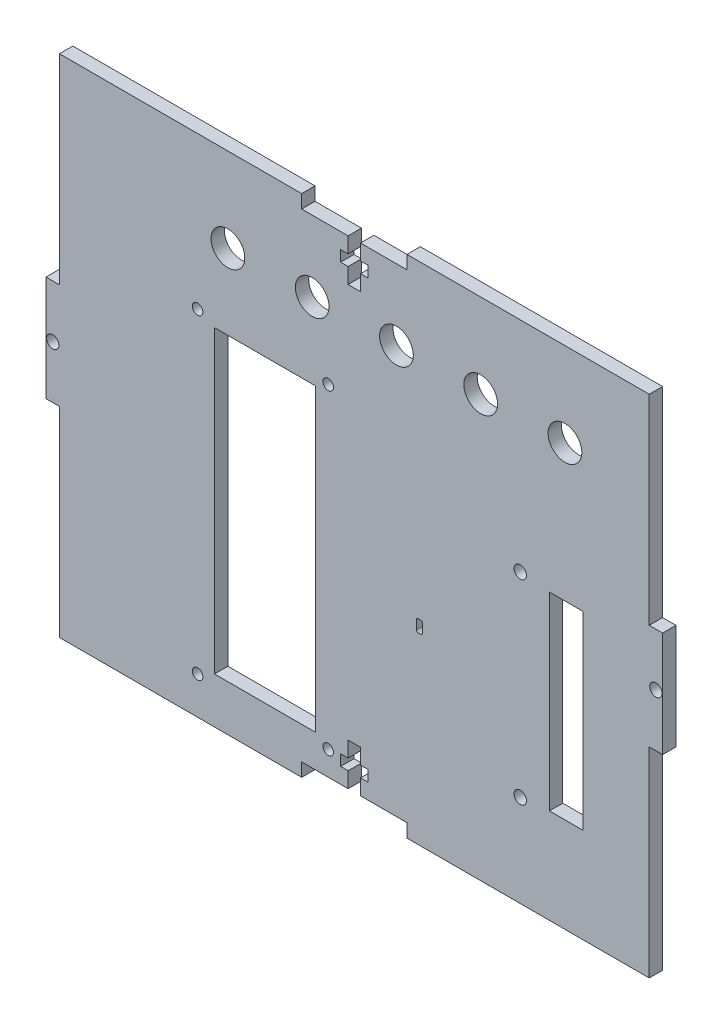
from build123d import *

# Parameters (mm, degrees)
SKETCH1_R           = 1.47
BOSS_EXTRUDE1_DEPTH = 1.5875
SKETCH3_W           = 8
SKETCH3_H           = 45
CUT_EXTRUDE1_DEPTH  = 95.681895049
SKETCH4_W           = 24
SKETCH4_H           = 71.2
CUT_EXTRUDE2_DEPTH  = 95.681895049
CUT_EXTRUDE4_DEPTH  = 95.681895049
SKETCH6_R           = 4
CUT_EXTRUDE5_DEPTH  = 95.681895049
SKETCH9_R           = 1.25
SKETCH9_R_2         = 1.47
CUT_EXTRUDE6_DEPTH  = 95.681895049


with BuildPart() as part:
    # Sketch1 → Boss-Extrude1 (new, symmetric)
    with BuildSketch(Plane.XY):
        Polygon((-12.5, 60), (-70, 60), (-70, 12.5), (-73.175, 12.5), (-73.175, -12.5), (-70, -12.5), (-70, -60), (-12.5, -60), (-12.5, -56.825), (-1.47, -56.825), (-1.47, -53.125), (-3.25, -53.125), (-3.25, -50.525), (-1.47, -50.525), (-1.47, -46.825), (1.47, -46.825), (1.47, -50.525), (3.25, -50.525), (3.25, -53.125), (1.47, -53.125), (1.47, -56.825), (12.5, -56.825), (12.5, -60), (70, -60), (70, -12.5), (73.175, -12.5), (73.175, 12.5), (70, 12.5), (70, 60), (12.5, 60), (12.5, 56.825), (1.47, 56.825), (1.47, 53.125), (3.25, 53.125), (3.25, 50.525), (1.47, 50.525), (1.47, 46.825), (-1.47, 46.825), (-1.47, 50.525), (-3.25, 50.525), (-3.25, 53.125), (-1.47, 53.125), (-1.47, 56.825), (-12.5, 56.825), align=None)
        with Locations((71.5875, 0)):
            Circle(SKETCH1_R, mode=Mode.SUBTRACT)
        with Locations((-71.5875, 0)):
            Circle(SKETCH1_R, mode=Mode.SUBTRACT)
    extrude(amount=BOSS_EXTRUDE1_DEPTH, both=True)

    # Sketch3 → Cut-Extrude1 (cut, through all)
    with BuildSketch(Plane(origin=(0, 0, -1.5875), x_dir=(-1, 0, 0), z_dir=(0, 0, -1))):
        with Locations((-50.3, -15)):
            Rectangle(SKETCH3_W, SKETCH3_H)
    extrude(amount=-CUT_EXTRUDE1_DEPTH, mode=Mode.SUBTRACT)

    # Sketch4 → Cut-Extrude2 (cut, through all)
    with BuildSketch(Plane(origin=(0, 0, -1.5875), x_dir=(-1, 0, 0), z_dir=(0, 0, -1))):
        with Locations((21.2, -13.494459363)):
            Rectangle(SKETCH4_W, SKETCH4_H)
    extrude(amount=-CUT_EXTRUDE2_DEPTH, mode=Mode.SUBTRACT)

    # Sketch5 → Cut-Extrude4 (cut, through all)
    with BuildSketch(Plane(origin=(0, 0, -1.5875), x_dir=(-1, 0, 0), z_dir=(0, 0, -1))):
        with BuildLine():
            Line((-15.153420736, -16.45), (-15.77915134, -16.45))
            ThreePointArc((-15.77915134, -16.45), (-16.043498683, -16.350200736), (-16.175937675, -16.10060241))
            ThreePointArc((-16.175937675, -16.10060241), (-16.245834875, -15), (-16.175937675, -13.89939759))
            ThreePointArc((-16.175937675, -13.89939759), (-16.043498683, -13.649799264), (-15.77915134, -13.55))
            Line((-15.77915134, -13.55), (-15.153420736, -13.55))
            ThreePointArc((-15.153420736, -13.55), (-14.870578023, -13.667157288), (-14.753420736, -13.95))
            Line((-14.753420736, -13.95), (-14.753420736, -16.05))
            ThreePointArc((-14.753420736, -16.05), (-14.870578023, -16.332842712), (-15.153420736, -16.45))
        make_face()
    extrude(amount=-CUT_EXTRUDE4_DEPTH, mode=Mode.SUBTRACT)

    # Sketch6 → Cut-Extrude5 (cut, through all)
    with BuildSketch(Plane(origin=(0, 0, -1.5875), x_dir=(-1, 0, 0), z_dir=(0, 0, -1))):
        with Locations((30, 40)):
            Circle(SKETCH6_R)
        with Locations((10, 40)):
            Circle(SKETCH6_R)
        with Locations((-10, 40)):
            Circle(SKETCH6_R)
        with Locations((-30, 40)):
            Circle(SKETCH6_R)
        with Locations((-50, 40)):
            Circle(SKETCH6_R)
    extrude(amount=-CUT_EXTRUDE5_DEPTH, mode=Mode.SUBTRACT)

    # Sketch9 → Cut-Extrude6 (cut, through all)
    with BuildSketch(Plane.XY.offset(1.5875)):
        with Locations((-37.2, 23.905540637)):
            Circle(SKETCH9_R)
        with Locations((-6.2, 23.905540637)):
            Circle(SKETCH9_R)
        with Locations((-6.2, -51.094459363)):
            Circle(SKETCH9_R)
        with Locations((-37.2, -51.094459363)):
            Circle(SKETCH9_R)
        with Locations((39.3875, 8.16125846)):
            Circle(SKETCH9_R_2)
        with Locations((39.3875, -38.16125846)):
            Circle(SKETCH9_R_2)
    extrude(amount=-CUT_EXTRUDE6_DEPTH, mode=Mode.SUBTRACT)


solid = part.part
